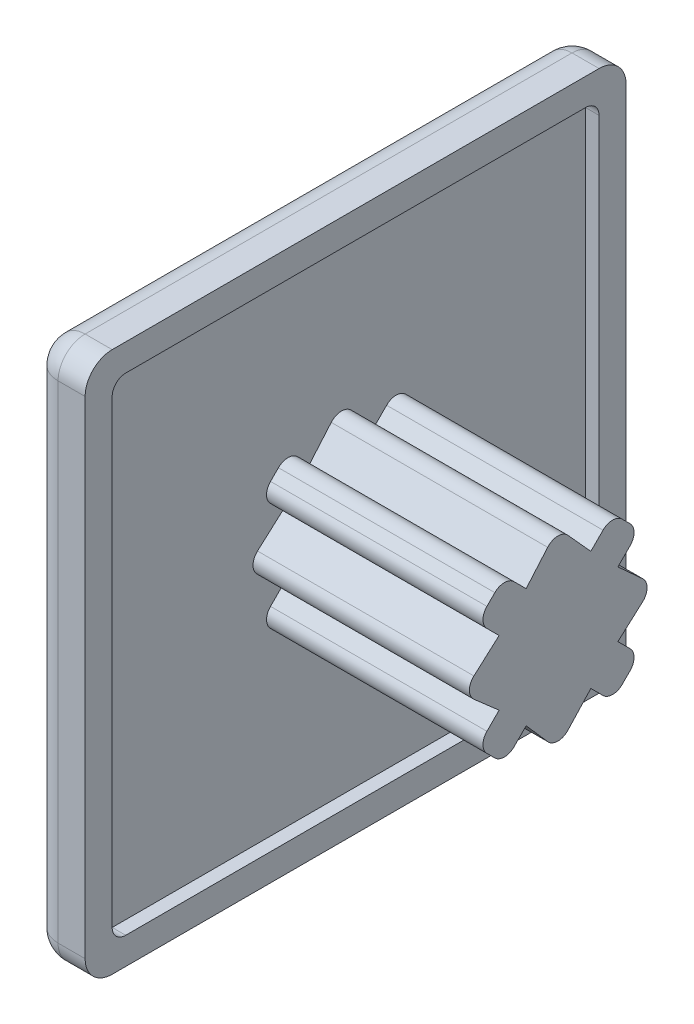
from build123d import *

# Parameters (mm, degrees)
SKETCH2_W           = 20
SKETCH2_H           = 20
BOSS_EXTRUDE1_DEPTH = 2
SKETCH3_W           = 18
SKETCH3_H           = 18
CUT_EXTRUDE1_DEPTH  = 0.5
FILLET1_R           = 1
FILLET2_R           = 1
FILLET3_R           = 0.5
BOSS_EXTRUDE3_DEPTH = 8
FILLET4_R           = 0.5


with BuildPart() as part:
    # Sketch2 → Boss-Extrude1 (new body)
    with BuildSketch(Plane(origin=(0, 0, 0), x_dir=(0, 0, -1), z_dir=(1, 0, 0))):
        with Locations((10, 10)):
            Rectangle(SKETCH2_W, SKETCH2_H)
    extrude(amount=BOSS_EXTRUDE1_DEPTH)

    # Sketch3 → Cut-Extrude1 (cut)
    with BuildSketch(Plane(origin=(2, 0, 0), x_dir=(0, 0, -1), z_dir=(1, 0, 0))):
        with Locations((10, 10)):
            Rectangle(SKETCH3_W, SKETCH3_H)
    extrude(amount=-CUT_EXTRUDE1_DEPTH, mode=Mode.SUBTRACT)

    # Fillet1
    fillet1_edges = [part.edges().sort_by_distance(p)[0] for p in [
        (0, 20, -10),
        (0, 10, -20),
        (0, 0, -10),
        (0, 10, 0),
    ]]
    fillet(fillet1_edges, radius=FILLET1_R)

    # Fillet2
    # the kernel refuses this fillet: 1 mm, written as the material it takes off along each edge
    with BuildSketch(Plane(origin=(1, 19, -1), x_dir=(0, 1, 0), z_dir=(0, 0, 1))) as fillet2_piece_1_section:
        Polygon((0, 0), (FILLET2_R, 0), (FILLET2_R, FILLET2_R), (0, FILLET2_R), align=None)
    fillet2_piece_1 = extrude(amount=FILLET2_R, mode=Mode.PRIVATE)
    fillet2_piece_1 = fillet2_piece_1 - Plane(origin=(1, 19, -1), x_dir=(0.7071067811865475, -0.7071067811865475, 0), z_dir=(0, 0, 1)) * Sphere(FILLET2_R, mode=Mode.PRIVATE)
    add(fillet2_piece_1, mode=Mode.SUBTRACT)
    with BuildSketch(Plane(origin=(1, 19, -19), x_dir=(0, 1, 0), z_dir=(0, 0, -1))) as fillet2_piece_2_section:
        Polygon((0, 0), (FILLET2_R, 0), (FILLET2_R, -FILLET2_R), (0, -FILLET2_R), align=None)
    fillet2_piece_2 = extrude(amount=FILLET2_R, mode=Mode.PRIVATE)
    fillet2_piece_2 = fillet2_piece_2 - Plane(origin=(1, 19, -19), x_dir=(0.7071067811865475, -0.7071067811865475, 0), z_dir=(0, 0, -1)) * Sphere(FILLET2_R, mode=Mode.PRIVATE)
    add(fillet2_piece_2, mode=Mode.SUBTRACT)
    with BuildSketch(Plane(origin=(1, 1, -1), x_dir=(0, 0, 1), z_dir=(0, -1, 0))) as fillet2_piece_3_section:
        Polygon((0, 0), (FILLET2_R, 0), (FILLET2_R, FILLET2_R), (0, FILLET2_R), align=None)
    fillet2_piece_3 = extrude(amount=FILLET2_R, mode=Mode.PRIVATE)
    fillet2_piece_3 = fillet2_piece_3 - Plane(origin=(1, 1, -1), x_dir=(0.7071067811865475, 0, -0.7071067811865475), z_dir=(0, -1, 0)) * Sphere(FILLET2_R, mode=Mode.PRIVATE)
    add(fillet2_piece_3, mode=Mode.SUBTRACT)
    with BuildSketch(Plane(origin=(1, 1, -19), x_dir=(0, 0, -1), z_dir=(0, -1, 0))) as fillet2_piece_4_section:
        Polygon((0, 0), (FILLET2_R, 0), (FILLET2_R, -FILLET2_R), (0, -FILLET2_R), align=None)
    fillet2_piece_4 = extrude(amount=FILLET2_R, mode=Mode.PRIVATE)
    fillet2_piece_4 = fillet2_piece_4 - Plane(origin=(1, 1, -19), x_dir=(0.7071067811865475, 0, 0.7071067811865475), z_dir=(0, -1, 0)) * Sphere(FILLET2_R, mode=Mode.PRIVATE)
    add(fillet2_piece_4, mode=Mode.SUBTRACT)
    with BuildSketch(Plane(origin=(1, 20, 0), x_dir=(0, -1, 0), z_dir=(1, 0, 0)), Plane(origin=(1, 0, 0), x_dir=(0, 0, -1), z_dir=(1, 0, 0))) as fillet2_piece_5:
        with BuildLine():
            CenterArc((FILLET2_R, FILLET2_R), FILLET2_R, 180, 90)
            Line((0, FILLET2_R), (0, 0))
            Line((0, 0), (FILLET2_R, 0))
        make_face()
    extrude(amount=3.5, mode=Mode.SUBTRACT)
    with BuildSketch(Plane(origin=(1, 20, -20), x_dir=(0, -1, 0), z_dir=(1, 0, 0)), Plane(origin=(1, 0, -20), x_dir=(0, 0, 1), z_dir=(1, 0, 0))) as fillet2_piece_6:
        with BuildLine():
            CenterArc((FILLET2_R, -FILLET2_R), FILLET2_R, 90, 90)
            Line((0, -FILLET2_R), (0, 0))
            Line((0, 0), (FILLET2_R, 0))
        make_face()
    extrude(amount=3.5, mode=Mode.SUBTRACT)

    # Fillet3
    fillet3_edges = [part.edges().sort_by_distance(p)[0] for p in [
        (1.75, 1, -1),
        (1.75, 19, -1),
        (1.75, 19, -19),
        (1.75, 1, -19),
    ]]
    fillet(fillet3_edges, radius=FILLET3_R)

    # Sketch5 → Boss-Extrude3 (add)
    with BuildSketch(Plane(origin=(1.5, 0, 0), x_dir=(0, 0, -1), z_dir=(1, 0, 0))):
        with BuildLine():
            Line((10.674031368, 12.407379911), (10.674031368, 12.772052319))
            Line((10.674031368, 12.772052319), (9.969031368, 13.551320747))
            Line((9.969031368, 13.551320747), (9.264031368, 12.730578714))
            Line((9.264031368, 12.730578714), (9.264031368, 12.389160229))
            ThreePointArc((9.264031368, 12.389160229), (9.967720161, 12.499742887), (10.674031368, 12.407379911))
        make_face()
        with BuildLine():
            ThreePointArc((8.804439368, 12.195534071), (9.029395093, 12.30383605), (9.264031368, 12.389160229))
            Line((9.264031368, 12.389160229), (9.264031368, 12.730578714))
            Line((9.264031368, 12.730578714), (8.804439368, 12.195534071))
        make_face()
        with BuildLine():
            ThreePointArc((10.674031368, 12.407379911), (10.940799854, 12.316184891), (11.19560436, 12.195534071))
            Line((11.19560436, 12.195534071), (10.674031368, 12.772052319))
            Line((10.674031368, 12.772052319), (10.674031368, 12.407379911))
        make_face()
        with BuildLine():
            Line((9.264031368, 12.195534071), (10.674031368, 12.195534071))
            Line((10.674031368, 12.195534071), (10.674031368, 12.407379911))
            ThreePointArc((10.674031368, 12.407379911), (9.967720161, 12.499742887), (9.264031368, 12.389160229))
            Line((9.264031368, 12.389160229), (9.264031368, 12.195534071))
        make_face()
        with BuildLine():
            Line((8.804439368, 12.195534071), (9.264031368, 12.195534071))
            Line((9.264031368, 12.195534071), (9.264031368, 12.389160229))
            ThreePointArc((9.264031368, 12.389160229), (9.029395093, 12.30383605), (8.804439368, 12.195534071))
        make_face()
        with BuildLine():
            Line((10.674031368, 12.195534071), (11.19560436, 12.195534071))
            ThreePointArc((11.19560436, 12.195534071), (10.940799854, 12.316184891), (10.674031368, 12.407379911))
            Line((10.674031368, 12.407379911), (10.674031368, 12.195534071))
        make_face()
        Polygon((10.000021864, 10.999951576), (10.674031368, 11.67396108), (10.674031368, 12.195534071), (9.264031368, 12.195534071), (9.264031368, 11.735942071), align=None)
        Polygon((9.264031368, 11.735942071), (9.264031368, 12.195534071), (8.804439368, 12.195534071), align=None)
        Polygon((10.674031368, 11.67396108), (11.19560436, 12.195534071), (10.674031368, 12.195534071), align=None)
        with BuildLine():
            ThreePointArc((12.19560436, 11.195534071), (11.767788817, 11.767718529), (11.19560436, 12.195534071))
            Line((11.19560436, 12.195534071), (10.674031368, 11.67396108))
            Line((10.674031368, 11.67396108), (10.674031368, 10.694356296))
            Line((10.674031368, 10.694356296), (11.694426585, 10.694356296))
            Line((11.694426585, 10.694356296), (12.19560436, 11.195534071))
        make_face()
        with BuildLine():
            Line((13.000021864, 11.999951576), (12.000021864, 12.999951576))
            Line((12.000021864, 12.999951576), (11.19560436, 12.195534071))
            ThreePointArc((11.19560436, 12.195534071), (11.767788817, 11.767718529), (12.19560436, 11.195534071))
            Line((12.19560436, 11.195534071), (13.000021864, 11.999951576))
        make_face()
        with BuildLine():
            Line((9.264031368, 10.694356296), (9.264031368, 11.735942071))
            Line((9.264031368, 11.735942071), (8.804439368, 12.195534071))
            ThreePointArc((8.804439368, 12.195534071), (8.232254911, 11.767718529), (7.804439368, 11.195534071))
            Line((7.804439368, 11.195534071), (8.305617143, 10.694356296))
            Line((8.305617143, 10.694356296), (9.264031368, 10.694356296))
        make_face()
        with BuildLine():
            ThreePointArc((7.804439368, 11.195534071), (8.232254911, 11.767718529), (8.804439368, 12.195534071))
            Line((8.804439368, 12.195534071), (8.000021864, 12.999951576))
            Line((8.000021864, 12.999951576), (7.000021864, 11.999951576))
            Line((7.000021864, 11.999951576), (7.804439368, 11.195534071))
        make_face()
        Polygon((9.694426585, 10.694356296), (10.000021864, 10.999951576), (9.264031368, 11.735942071), (9.264031368, 10.694356296), align=None)
        Polygon((10.674031368, 10.694356296), (10.674031368, 11.67396108), (10.000021864, 10.999951576), (10.305617143, 10.694356296), align=None)
        Polygon((10.305617143, 10.694356296), (10.000021864, 10.999951576), (9.694426585, 10.694356296), align=None)
        Polygon((9.264031368, 10.26396108), (9.694426585, 10.694356296), (9.264031368, 10.694356296), align=None)
        Polygon((9.000021864, 9.999951576), (9.264031368, 10.26396108), (9.264031368, 10.694356296), (8.305617143, 10.694356296), align=None)
        Polygon((10.305617143, 10.694356296), (9.694426585, 10.694356296), (9.264031368, 10.26396108), (9.264031368, 9.735942071), (9.715617143, 9.284356296), (10.284426585, 9.284356296), (10.674031368, 9.67396108), (10.674031368, 10.325942071), align=None)
        Polygon((11.000021864, 9.999951576), (11.694426585, 10.694356296), (10.674031368, 10.694356296), (10.674031368, 10.325942071), align=None)
        Polygon((9.264031368, 9.735942071), (9.264031368, 10.26396108), (9.000021864, 9.999951576), align=None)
        Polygon((10.674031368, 9.67396108), (11.000021864, 9.999951576), (10.674031368, 10.325942071), align=None)
        Polygon((10.674031368, 10.325942071), (10.674031368, 10.694356296), (10.305617143, 10.694356296), align=None)
        with BuildLine():
            Line((7.804439368, 10.694356296), (7.804439368, 11.195534071))
            ThreePointArc((7.804439368, 11.195534071), (7.687799186, 10.950544173), (7.59839698, 10.694356296))
            Line((7.59839698, 10.694356296), (7.804439368, 10.694356296))
        make_face()
        with BuildLine():
            Line((7.804439368, 9.284356296), (7.804439368, 10.694356296))
            Line((7.804439368, 10.694356296), (7.59839698, 10.694356296))
            ThreePointArc((7.59839698, 10.694356296), (7.500046256, 9.988908081), (7.604625572, 9.284356296))
            Line((7.604625572, 9.284356296), (7.804439368, 9.284356296))
        make_face()
        with BuildLine():
            ThreePointArc((7.59839698, 10.694356296), (7.687799186, 10.950544173), (7.804439368, 11.195534071))
            Line((7.804439368, 11.195534071), (7.241968907, 10.694356296))
            Line((7.241968907, 10.694356296), (7.59839698, 10.694356296))
        make_face()
        with BuildLine():
            Line((7.59839698, 10.694356296), (7.241968907, 10.694356296))
            Line((7.241968907, 10.694356296), (6.450749314, 9.989356296))
            Line((6.450749314, 9.989356296), (7.256117908, 9.284356296))
            Line((7.256117908, 9.284356296), (7.604625572, 9.284356296))
            ThreePointArc((7.604625572, 9.284356296), (7.500046256, 9.988908081), (7.59839698, 10.694356296))
        make_face()
        Polygon((8.284426585, 9.284356296), (9.000021864, 9.999951576), (8.305617143, 10.694356296), (7.804439368, 10.694356296), (7.804439368, 9.284356296), align=None)
        Polygon((8.305617143, 10.694356296), (7.804439368, 11.195534071), (7.804439368, 10.694356296), align=None)
        with BuildLine():
            Line((7.804439368, 8.80436908), (7.804439368, 9.284356296))
            Line((7.804439368, 9.284356296), (7.604625572, 9.284356296))
            ThreePointArc((7.604625572, 9.284356296), (7.692020891, 9.039154245), (7.804439368, 8.80436908))
        make_face()
        Polygon((7.804439368, 8.80436908), (8.284426585, 9.284356296), (7.804439368, 9.284356296), align=None)
        with BuildLine():
            Line((9.264031368, 9.284356296), (8.284426585, 9.284356296))
            Line((8.284426585, 9.284356296), (7.804439368, 8.80436908))
            ThreePointArc((7.804439368, 8.80436908), (8.232254911, 8.232184623), (8.804439368, 7.80436908))
            Line((8.804439368, 7.80436908), (9.264031368, 8.26396108))
            Line((9.264031368, 8.26396108), (9.264031368, 9.284356296))
        make_face()
        Polygon((9.264031368, 9.735942071), (9.000021864, 9.999951576), (8.284426585, 9.284356296), (9.264031368, 9.284356296), align=None)
        Polygon((9.715617143, 9.284356296), (9.264031368, 9.735942071), (9.264031368, 9.284356296), align=None)
        Polygon((9.264031368, 8.26396108), (10.000021864, 8.999951576), (9.715617143, 9.284356296), (9.264031368, 9.284356296), align=None)
        Polygon((9.264031368, 7.80436908), (9.264031368, 8.26396108), (8.804439368, 7.80436908), align=None)
        Polygon((10.674031368, 8.325942071), (10.000021864, 8.999951576), (9.264031368, 8.26396108), (9.264031368, 7.80436908), (10.674031368, 7.80436908), align=None)
        with BuildLine():
            Line((10.674031368, 7.592523241), (10.674031368, 7.80436908))
            Line((10.674031368, 7.80436908), (9.264031368, 7.80436908))
            Line((9.264031368, 7.80436908), (9.264031368, 7.610742922))
            ThreePointArc((9.264031368, 7.610742922), (9.967720161, 7.500160264), (10.674031368, 7.592523241))
        make_face()
        with BuildLine():
            Line((12.19560436, 8.80436908), (11.715617143, 9.284356296))
            Line((11.715617143, 9.284356296), (10.674031368, 9.284356296))
            Line((10.674031368, 9.284356296), (10.674031368, 8.325942071))
            Line((10.674031368, 8.325942071), (11.19560436, 7.80436908))
            ThreePointArc((11.19560436, 7.80436908), (11.767788817, 8.232184623), (12.19560436, 8.80436908))
        make_face()
        Polygon((10.674031368, 9.284356296), (10.284426585, 9.284356296), (10.000021864, 8.999951576), (10.674031368, 8.325942071), align=None)
        Polygon((10.000021864, 8.999951576), (10.284426585, 9.284356296), (9.715617143, 9.284356296), align=None)
        Polygon((10.674031368, 9.284356296), (10.674031368, 9.67396108), (10.284426585, 9.284356296), align=None)
        Polygon((11.715617143, 9.284356296), (11.000021864, 9.999951576), (10.674031368, 9.67396108), (10.674031368, 9.284356296), align=None)
        Polygon((12.19560436, 10.694356296), (11.694426585, 10.694356296), (11.000021864, 9.999951576), (11.715617143, 9.284356296), (12.19560436, 9.284356296), align=None)
        Polygon((12.19560436, 10.694356296), (12.19560436, 11.195534071), (11.694426585, 10.694356296), align=None)
        with BuildLine():
            ThreePointArc((12.401646748, 10.694356296), (12.312244542, 10.950544173), (12.19560436, 11.195534071))
            Line((12.19560436, 11.195534071), (12.19560436, 10.694356296))
            Line((12.19560436, 10.694356296), (12.401646748, 10.694356296))
        make_face()
        with BuildLine():
            Line((12.401646748, 10.694356296), (12.19560436, 10.694356296))
            Line((12.19560436, 10.694356296), (12.19560436, 9.284356296))
            Line((12.19560436, 9.284356296), (12.395418156, 9.284356296))
            ThreePointArc((12.395418156, 9.284356296), (12.473732713, 9.638351472), (12.500021864, 9.999951576))
            ThreePointArc((12.500021864, 9.999951576), (12.475305909, 10.350620786), (12.401646748, 10.694356296))
        make_face()
        Polygon((12.19560436, 8.80436908), (12.19560436, 9.284356296), (11.715617143, 9.284356296), align=None)
        with BuildLine():
            Line((12.395418156, 9.284356296), (12.19560436, 9.284356296))
            Line((12.19560436, 9.284356296), (12.19560436, 8.80436908))
            ThreePointArc((12.19560436, 8.80436908), (12.308022836, 9.039154245), (12.395418156, 9.284356296))
        make_face()
        with BuildLine():
            Line((13.520749314, 9.989356296), (12.746214074, 10.694356296))
            Line((12.746214074, 10.694356296), (12.401646748, 10.694356296))
            ThreePointArc((12.401646748, 10.694356296), (12.475305909, 10.350620786), (12.500021864, 9.999951576))
            ThreePointArc((12.500021864, 9.999951576), (12.473732713, 9.638351472), (12.395418156, 9.284356296))
            Line((12.395418156, 9.284356296), (12.732363431, 9.284356296))
            Line((12.732363431, 9.284356296), (13.520749314, 9.989356296))
        make_face()
        with BuildLine():
            Line((12.19560436, 8.80436908), (12.732363431, 9.284356296))
            Line((12.732363431, 9.284356296), (12.395418156, 9.284356296))
            ThreePointArc((12.395418156, 9.284356296), (12.308022836, 9.039154245), (12.19560436, 8.80436908))
        make_face()
        with BuildLine():
            Line((12.746214074, 10.694356296), (12.19560436, 11.195534071))
            ThreePointArc((12.19560436, 11.195534071), (12.312244542, 10.950544173), (12.401646748, 10.694356296))
            Line((12.401646748, 10.694356296), (12.746214074, 10.694356296))
        make_face()
        Polygon((10.674031368, 7.80436908), (11.19560436, 7.80436908), (10.674031368, 8.325942071), align=None)
        with BuildLine():
            ThreePointArc((10.674031368, 7.592523241), (10.940799854, 7.68371826), (11.19560436, 7.80436908))
            Line((11.19560436, 7.80436908), (10.674031368, 7.80436908))
            Line((10.674031368, 7.80436908), (10.674031368, 7.592523241))
        make_face()
        with BuildLine():
            Line((9.264031368, 7.610742922), (9.264031368, 7.80436908))
            Line((9.264031368, 7.80436908), (8.804439368, 7.80436908))
            ThreePointArc((8.804439368, 7.80436908), (9.029395093, 7.696067101), (9.264031368, 7.610742922))
        make_face()
        with BuildLine():
            Line((9.264031368, 7.282244225), (9.264031368, 7.610742922))
            ThreePointArc((9.264031368, 7.610742922), (9.029395093, 7.696067101), (8.804439368, 7.80436908))
            Line((8.804439368, 7.80436908), (9.264031368, 7.282244225))
        make_face()
        with BuildLine():
            Line((9.969031368, 6.481320747), (10.674031368, 7.241772087))
            Line((10.674031368, 7.241772087), (10.674031368, 7.592523241))
            ThreePointArc((10.674031368, 7.592523241), (9.967720161, 7.500160264), (9.264031368, 7.610742922))
            Line((9.264031368, 7.610742922), (9.264031368, 7.282244225))
            Line((9.264031368, 7.282244225), (9.969031368, 6.481320747))
        make_face()
        with BuildLine():
            Line((10.674031368, 7.241772087), (11.19560436, 7.80436908))
            ThreePointArc((11.19560436, 7.80436908), (10.940799854, 7.68371826), (10.674031368, 7.592523241))
            Line((10.674031368, 7.592523241), (10.674031368, 7.241772087))
        make_face()
        with BuildLine():
            ThreePointArc((8.804439368, 7.80436908), (8.232254911, 8.232184623), (7.804439368, 8.80436908))
            Line((7.804439368, 8.80436908), (7.000021864, 7.999951576))
            Line((7.000021864, 7.999951576), (8.000021864, 6.999951576))
            Line((8.000021864, 6.999951576), (8.804439368, 7.80436908))
        make_face()
        with BuildLine():
            Line((13.000021864, 7.999951576), (12.19560436, 8.80436908))
            ThreePointArc((12.19560436, 8.80436908), (11.767788817, 8.232184623), (11.19560436, 7.80436908))
            Line((11.19560436, 7.80436908), (12.000021864, 6.999951576))
            Line((12.000021864, 6.999951576), (13.000021864, 7.999951576))
        make_face()
        with BuildLine():
            ThreePointArc((7.804439368, 8.80436908), (7.692020891, 9.039154245), (7.604625572, 9.284356296))
            Line((7.604625572, 9.284356296), (7.256117908, 9.284356296))
            Line((7.256117908, 9.284356296), (7.804439368, 8.80436908))
        make_face()
    extrude(amount=BOSS_EXTRUDE3_DEPTH)

    # Fillet4
    fillet4_edges = [part.edges().sort_by_distance(p)[0] for p in [
        (5.5, 6.999951576, -8.000021864),
        (5.5, 6.481320747, -9.969031368),
        (5.5, 6.999951576, -12.000021864),
        (5.5, 7.999951576, -13.000021864),
        (5.5, 9.989356296, -13.520749314),
        (5.5, 11.999951576, -13.000021864),
        (5.5, 12.999951576, -12.000021864),
        (5.5, 13.551320747, -9.969031368),
        (5.5, 12.999951576, -8.000021864),
        (5.5, 11.999951576, -7.000021864),
        (5.5, 9.989356296, -6.450749314),
        (5.5, 7.999951576, -7.000021864),
    ]]
    fillet(fillet4_edges, radius=FILLET4_R)


solid = part.part
